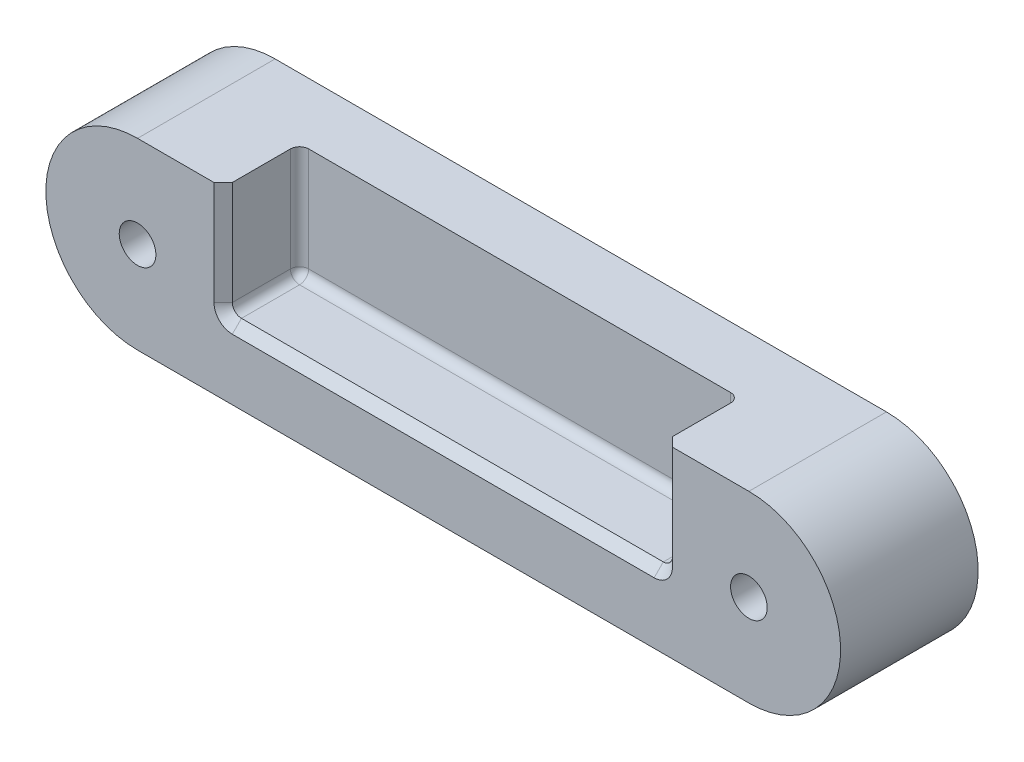
from build123d import *

# Parameters (mm, degrees)
SKETCH1_R           = 6
BOSS_EXTRUDE1_DEPTH = 45
SKETCH2_W           = 144
SKETCH2_H           = 37
CUT_EXTRUDE1_DEPTH  = 25
FILLET1_R           = 3
CHAMFER1_SIZE       = 3


with BuildPart() as part:
    # Sketch1 → Boss-Extrude1 (new body)
    with BuildSketch(Plane.XY):
        with BuildLine():
            Line((-100, 30), (100, 30))
            ThreePointArc((100, 30), (130, 0), (100, -30))
            Line((100, -30), (-100, -30))
            ThreePointArc((-100, -30), (-130, 0), (-100, 30))
        make_face()
        with Locations((-100, 0)):
            Circle(SKETCH1_R, mode=Mode.SUBTRACT)
        with Locations((100, 0)):
            Circle(SKETCH1_R, mode=Mode.SUBTRACT)
    extrude(amount=BOSS_EXTRUDE1_DEPTH)

    # Sketch2 → Cut-Extrude1 (cut)
    with BuildSketch(Plane.XY.offset(45)):
        with Locations((0, 11.5)):
            Rectangle(SKETCH2_W, SKETCH2_H)
    extrude(amount=-CUT_EXTRUDE1_DEPTH, mode=Mode.SUBTRACT)

    # Fillet1
    fillet1_edges = [part.edges().sort_by_distance(p)[0] for p in [
        (72, 11.5, 20),
        (0, -7, 20),
        (-72, 11.5, 20),
        (72, -7, 32.5),
        (-72, -7, 32.5),
    ]]
    fillet(fillet1_edges, radius=FILLET1_R)

    # Chamfer1
    chamfer1_edges = [part.edges().sort_by_distance(p)[0] for p in [
        (72, 13, 45),
        (0, -7, 45),
        (-72, 13, 45),
        (71.121320344, -6.121320344, 45),
        (-71.121320344, -6.121320344, 45),
    ]]
    chamfer(chamfer1_edges, length=CHAMFER1_SIZE)


solid = part.part
